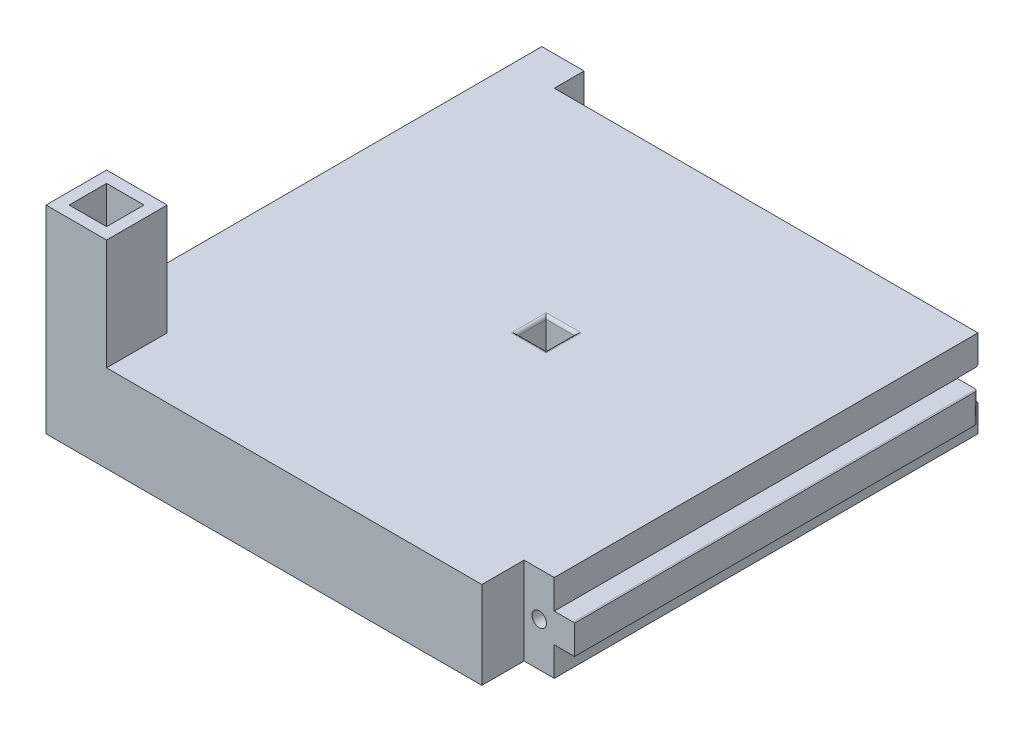
from build123d import *

# Parameters (mm, degrees)
SKETCH1_W                                           = 159.95
SKETCH1_H                                           = 159.95
BOSS_EXTRUDE2_DEPTH                                 = 30
SKETCH3_W                                           = 7
SKETCH3_H                                           = 10
BOSS_EXTRUDE4_DEPTH                                 = 145.45
CHAMFER1_SIZE                                       = 0.508
CHAMFER1_SIZE2                                      = 0.03552282
CHAMFER2_SIZE                                       = 0.508
CHAMFER2_SIZE2                                      = 0.03552282
SKETCH4_W                                           = 7.1
SKETCH4_H                                           = 10.2
CUT_EXTRUDE6_DEPTH                                  = 160.2
FILLET1_R                                           = 1
SKETCH6_W                                           = 10.35
SKETCH6_H                                           = 14.5
CUT_EXTRUDE7_DEPTH                                  = 80
BOSS_EXTRUDE5_REACH                                 = 206.773
SKETCH7_W                                           = 14.5
SKETCH7_H                                           = 10.25
CSK_FOR_M4_COUNTERSUNK_FLAT_HEAD_SCREW1_D           = 4.5
CSK_FOR_M4_COUNTERSUNK_FLAT_HEAD_SCREW1_DEPTH       = 16
CSK_FOR_M4_COUNTERSUNK_FLAT_HEAD_SCREW1_CSINK_D     = 9.4
CSK_FOR_M4_COUNTERSUNK_FLAT_HEAD_SCREW1_CSINK_ANGLE = 90
CSK_FOR_M4_COUNTERSUNK_FLAT_HEAD_SCREW1_TIP         = 1.351936393
SKETCH12_R                                          = 2.5
CUT_EXTRUDE9_DEPTH                                  = 5
FILLET2_START                                       = -15.571212121
FILLET2_DEPTH                                       = 154.571212121
FILLET3_START                                       = -15.571212121
FILLET3_DEPTH                                       = 154.571212121
M2_TAPPED_HOLE1_D                                   = 1.6
M2_TAPPED_HOLE1_DEPTH                               = 5.2
M2_TAPPED_HOLE1_TIP                                 = 0.480688495
SKETCH29_W                                          = 20.8
SKETCH29_H                                          = 20.8
SKETCH29_W_2                                        = 12.85
SKETCH29_H_2                                        = 12.85
BOSS_EXTRUDE6_DEPTH                                 = 38
CUT_EXTRUDE15_DEPTH                                 = 207.096620322
CUT_EXTRUDE15_DEPTH_BACK                            = 207.096620322
SKETCH26_W                                          = 10
SKETCH26_H                                          = 10
CUT_EXTRUDE16_DEPTH                                 = 8.5
CUT_EXTRUDE16_DEPTH_BACK                            = 98.4
SKETCH30_W                                          = 10
SKETCH30_H                                          = 10
SKETCH31_W                                          = 12.85
SKETCH31_H                                          = 12.85
CUT_EXTRUDE17_DEPTH                                 = 20
FILLET4_R                                           = 1


with BuildPart() as part:
    # Sketch1 → Boss-Extrude2 (new body)
    with BuildSketch(Plane(origin=(0, 0, 0), x_dir=(1, 0, 0), z_dir=(0, 1, 0))):
        with Locations((57.653787879, -61.85)):
            Rectangle(SKETCH1_W, SKETCH1_H)
    extrude(amount=BOSS_EXTRUDE2_DEPTH)

    # Sketch3 → Boss-Extrude4 (add)
    with BuildSketch(Plane.XY.offset(-18.125)):
        with Locations((141.128787879, 15)):
            Rectangle(SKETCH3_W, SKETCH3_H)
    extrude(amount=BOSS_EXTRUDE4_DEPTH)

    # Chamfer1
    chamfer1_edges = [part.edges().sort_by_distance(p)[0] for p in [
        (144.628787879, 20, 54.6),
    ]]
    chamfer1_side = [part.faces().sort_by_distance(p)[0] for p in [
        (141.128787879, 20, 54.6),
    ]]
    chamfer(chamfer1_edges, length=CHAMFER1_SIZE, length2=CHAMFER1_SIZE2, reference=chamfer1_side[0])

    # Chamfer2
    chamfer2_edges = [part.edges().sort_by_distance(p)[0] for p in [
        (144.628787879, 10, 54.6),
    ]]
    chamfer2_side = [part.faces().sort_by_distance(p)[0] for p in [
        (141.128787879, 10, 54.6),
    ]]
    chamfer(chamfer2_edges, length=CHAMFER2_SIZE, length2=CHAMFER2_SIZE2, reference=chamfer2_side[0])

    # Sketch4 → Cut-Extrude6 (cut)
    with BuildSketch(Plane.ZY.offset(-144.628787879)):
        with Locations((-14.575, 15)):
            Rectangle(SKETCH4_W, SKETCH4_H)
    extrude(amount=CUT_EXTRUDE6_DEPTH, mode=Mode.SUBTRACT)

    # Fillet1
    fillet1_edges = [part.edges().sort_by_distance(p)[0] for p in [
        (144.628787879, 15, -11.025),
    ]]
    fillet(fillet1_edges, radius=FILLET1_R)

    # Sketch6 → Cut-Extrude7 (cut)
    with BuildSketch(Plane(origin=(0, 30, 0), x_dir=(1, 0, 0), z_dir=(0, 1, 0))):
        with Locations((132.453787879, -134.575)):
            Rectangle(SKETCH6_W, SKETCH6_H)
    extrude(amount=-CUT_EXTRUDE7_DEPTH, mode=Mode.SUBTRACT)

    # Boss-Extrude5: up to this face of the body (flat: up to its plane)
    boss_extrude5_end = Plane(part.part.faces().sort_by_distance((57.212424271, 0, 61.420880102))[0])
    # Sketch7 → Boss-Extrude5 (add, up to the picked face)
    with BuildSketch(Plane(origin=(0, 30, 0), x_dir=(1, 0, 0), z_dir=(0, 1, 0)), mode=Mode.PRIVATE) as boss_extrude5_sk1:
        with Locations((-15.071212121, 23.25)):
            Rectangle(SKETCH7_W, SKETCH7_H)
    boss_extrude5_tool1 = split(extrude(boss_extrude5_sk1.sketch, amount=-BOSS_EXTRUDE5_REACH, mode=Mode.PRIVATE), bisect_by=boss_extrude5_end, keep=Keep.BOTH, mode=Mode.PRIVATE)
    add(boss_extrude5_tool1.solids().sort_by(Axis((-15.071212, 30, -23.25), (0, -1, 0)))[0])

    # CSK for M4 Countersunk Flat Head Screw1
    with Locations(Plane.ZY.offset(22.321212121)):
        with Locations((-21, 15)):
            CounterSinkHole(CSK_FOR_M4_COUNTERSUNK_FLAT_HEAD_SCREW1_D / 2, CSK_FOR_M4_COUNTERSUNK_FLAT_HEAD_SCREW1_CSINK_D / 2, depth=CSK_FOR_M4_COUNTERSUNK_FLAT_HEAD_SCREW1_DEPTH, counter_sink_angle=CSK_FOR_M4_COUNTERSUNK_FLAT_HEAD_SCREW1_CSINK_ANGLE)
            with Locations((0, 0, -(CSK_FOR_M4_COUNTERSUNK_FLAT_HEAD_SCREW1_DEPTH + CSK_FOR_M4_COUNTERSUNK_FLAT_HEAD_SCREW1_TIP / 2))):  # 118° drill point
                Cone(0, CSK_FOR_M4_COUNTERSUNK_FLAT_HEAD_SCREW1_D / 2, CSK_FOR_M4_COUNTERSUNK_FLAT_HEAD_SCREW1_TIP, mode=Mode.SUBTRACT)

    # Sketch12 → Cut-Extrude9 (cut)
    with BuildSketch(Plane.XY.offset(127.325)):
        with Locations((132.453787879, 15)):
            Circle(SKETCH12_R)
    extrude(amount=-CUT_EXTRUDE9_DEPTH, mode=Mode.SUBTRACT)

    # Fillet2: read off the stored shape, not the designer's step
    # Fillet2 outline → Fillet2 (cut)
    with BuildSketch(Plane.YZ.offset(FILLET2_START)):
        with BuildLine():
            Line((20.1, -18.125), (21.1, -18.125))
            ThreePointArc((21.1, -18.125), (20.392893219, -17.832106781), (20.1, -17.125))
            Line((20.1, -17.125), (20.1, -18.125))
        make_face()
    extrude(amount=FILLET2_DEPTH, mode=Mode.SUBTRACT)

    # Fillet3: read off the stored shape, not the designer's step
    # Fillet3 outline → Fillet3 (cut)
    with BuildSketch(Plane.YZ.offset(FILLET3_START)):
        with BuildLine():
            ThreePointArc((9.9, -17.125), (9.607106781, -17.832106781), (8.9, -18.125))
            Line((8.9, -18.125), (9.9, -18.125))
            Line((9.9, -18.125), (9.9, -17.125))
        make_face()
    extrude(amount=FILLET3_DEPTH, mode=Mode.SUBTRACT)

    # M2 Tapped Hole1
    with Locations(Plane.XZ):
        with Locations((77.628787879, 41.875)):
            Hole(M2_TAPPED_HOLE1_D / 2, depth=M2_TAPPED_HOLE1_DEPTH)
            with Locations((0, 0, -(M2_TAPPED_HOLE1_DEPTH + M2_TAPPED_HOLE1_TIP / 2))):  # 118° drill point
                Cone(0, M2_TAPPED_HOLE1_D / 2, M2_TAPPED_HOLE1_TIP, mode=Mode.SUBTRACT)

    # Sketch29 → Boss-Extrude6 (add)
    with BuildSketch(Plane(origin=(0, 30, 0), x_dir=(1, 0, 0), z_dir=(0, 1, 0))):
        with Locations((-11.921212121, -131.425)):
            Rectangle(SKETCH29_W, SKETCH29_H)
        with Locations((-11.921212121, -131.425)):
            Rectangle(SKETCH29_W_2, SKETCH29_H_2, mode=Mode.SUBTRACT)
    extrude(amount=BOSS_EXTRUDE6_DEPTH)

    # Sketch26 → Cut-Extrude15 (cut, two sides: drawn at the far end of the back side and taken through both)
    with BuildSketch(Plane(origin=(0, 30, 0), x_dir=(1, 0, 0), z_dir=(0, 1, 0)).offset(-CUT_EXTRUDE15_DEPTH_BACK)):
        with Locations((63.528787879, -55.975)):
            Rectangle(SKETCH26_W, SKETCH26_H)
    extrude(amount=CUT_EXTRUDE15_DEPTH + CUT_EXTRUDE15_DEPTH_BACK, mode=Mode.SUBTRACT)

    # Sketch30 → Cut-Extrude16 (cut, two sides: drawn at the far end of the back side and taken through both)
    with BuildSketch(Plane(origin=(-2.098106061, 0, 2.098106061), x_dir=(-0.7071067811865477, 0, -0.7071067811865475), z_dir=(0.7071067811865475, 0, -0.7071067811865477)).offset(-CUT_EXTRUDE16_DEPTH_BACK)):
        with Locations((-84.501938787, 15)):
            Rectangle(SKETCH30_W, SKETCH30_H)
    extrude(amount=CUT_EXTRUDE16_DEPTH + CUT_EXTRUDE16_DEPTH_BACK, mode=Mode.SUBTRACT)

    # Sketch31 → Cut-Extrude17 (cut)
    with BuildSketch(Plane(origin=(0, 30, 0), x_dir=(1, 0, 0), z_dir=(0, 1, 0))):
        with Locations((-11.921212121, -131.425)):
            Rectangle(SKETCH31_W, SKETCH31_H)
    extrude(amount=-CUT_EXTRUDE17_DEPTH, mode=Mode.SUBTRACT)

    # Fillet4
    fillet4_edges = [part.edges().sort_by_distance(p)[0] for p in [
        (58.528787879, 30, 55.975),
        (63.528787879, 30, 60.975),
        (68.528787879, 30, 55.975),
        (63.528787879, 30, 50.975),
    ]]
    fillet(fillet4_edges, radius=FILLET4_R)


solid = part.part
